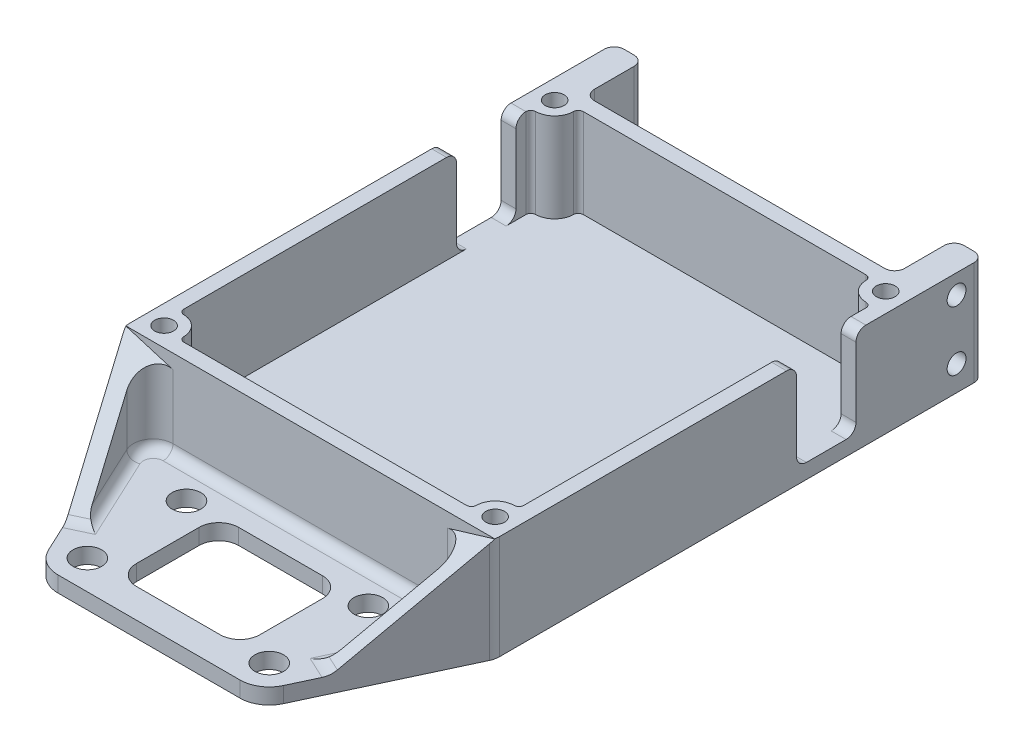
from build123d import *

# Parameters (mm, degrees)
SKETCH1_W           = 74.6
SKETCH1_H           = 86.6
BOSS_EXTRUDE1_DEPTH = 21
SHELL1_T            = -3
SKETCH3_R           = 2.9
SKETCH3_W           = 24.9
SKETCH3_H           = 20.6375
BOSS_EXTRUDE2_DEPTH = 3.175
FILLET2_R           = 4
BOSS_EXTRUDE3_DEPTH = 3
FILLET3_R           = 4
FILLET4_R           = 4
FILLET5_R           = 2
SKETCH5_W           = 12
SKETCH5_H           = 20
CUT_EXTRUDE1_DEPTH  = 37.3
CUT_EXTRUDE2_DEPTH  = 37.3
FILLET6_R           = 2
BOSS_EXTRUDE4_DEPTH = 21
FILLET7_R           = 2
FILLET8_R           = 2
SKETCH8_R           = 1.9
CUT_EXTRUDE3_DEPTH  = 5
SKETCH9_R           = 3.9
BOSS_EXTRUDE5_DEPTH = 21
FILLET9_R           = 1
CUT_EXTRUDE4_START  = -10
SKETCH10_R          = 1.9
CUT_EXTRUDE4_DEPTH  = 10


with BuildPart() as part:
    # Sketch1 → Boss-Extrude1 (new body)
    with BuildSketch(Plane(origin=(0, 0, 0), x_dir=(1, 0, 0), z_dir=(0, 1, 0))):
        Rectangle(SKETCH1_W, SKETCH1_H)
    extrude(amount=BOSS_EXTRUDE1_DEPTH)

    # Shell1
    shell1_openings = [part.faces().sort_by_distance(p)[0] for p in [
        (0, 21, 0),
    ]]
    offset(amount=SHELL1_T, openings=shell1_openings, kind=Kind.INTERSECTION)

    # Sketch3 → Boss-Extrude2 (add)
    with BuildSketch(Plane(origin=(0, 0, 0), x_dir=(1, 0, 0), z_dir=(0, 1, 0))):
        with BuildLine():
            Line((-37.3, -43.3), (-23.695893814, -72.433781099))
            ThreePointArc((-23.695893814, -72.433781099), (-21.518749084, -74.914349329), (-18.35, -75.8375))
            Line((-18.35, -75.8375), (18.35, -75.8375))
            ThreePointArc((18.35, -75.8375), (21.518749084, -74.914349329), (23.695893814, -72.433781099))
            Line((23.695893814, -72.433781099), (37.3, -43.3))
            Line((37.3, -43.3), (-37.3, -43.3))
        make_face()
        with Locations(Location((-18.35, -69.9375, 0), (0, 0, 270))):
            Circle(SKETCH3_R, mode=Mode.SUBTRACT)
        with Locations(Location((18.35, -69.9375, 0), (0, 0, 270))):
            Circle(SKETCH3_R, mode=Mode.SUBTRACT)
        with Locations(Location((18.35, -49.9375, 0), (0, 0, 270))):
            Circle(SKETCH3_R, mode=Mode.SUBTRACT)
        with Locations(Location((-18.35, -49.9375, 0), (0, 0, 270))):
            Circle(SKETCH3_R, mode=Mode.SUBTRACT)
        with Locations((0, -59.61875)):
            Rectangle(SKETCH3_W, SKETCH3_H, mode=Mode.SUBTRACT)
    extrude(amount=BOSS_EXTRUDE2_DEPTH)

    # Fillet2
    fillet2_edges = [part.edges().sort_by_distance(p)[0] for p in [
        (12.45, 1.5875, 69.9375),
        (12.45, 1.5875, 49.3),
        (-12.45, 1.5875, 49.3),
        (-12.45, 1.5875, 69.9375),
    ]]
    fillet(fillet2_edges, radius=FILLET2_R)

    # Sketch4 → Boss-Extrude3 (add)
    with BuildSketch(Plane(origin=(47.22244251, 0, 22.050660711), x_dir=(0.4230984913948713, 0, -0.9060836973367219), z_dir=(0.9060836973367219, 0, 0.4230984913948713))):
        Polygon((-23.451850366, 3.175), (-23.451850366, 21), (-48.451850366, 3.175), align=None)
    boss_extrude3 = extrude(amount=-BOSS_EXTRUDE3_DEPTH)

    # Mirror1: Boss-Extrude3 across plane
    add(boss_extrude3.mirror(Plane(origin=(0, 0, 0), x_dir=(0, 0, 1), z_dir=(1, 0, 0))))

    # Fillet3
    # the kernel refuses this fillet: 4 mm, written as the material it adds along each edge
    with BuildSketch(Plane(origin=(33.989047591, 35.70722548, 43.3), x_dir=(-1, 0, 0), z_dir=(0, -1, 0))) as fillet3_piece_1_section:
        with BuildLine():
            CenterArc((FILLET3_R * 1.57060379254, -FILLET3_R), FILLET3_R, 90, 115.030363343)
            Line((FILLET3_R * 0.664520095202, -FILLET3_R * 1.42309849139), (0, 0))
            Line((0, 0), (FILLET3_R * 1.57060379254, 0))
        make_face()
    fillet3_piece_1 = extrude(amount=32.53222548, mode=Mode.PRIVATE)
    fillet3_piece_1 = split(fillet3_piece_1, bisect_by=Plane(origin=(30.311758397, 15.920235221, 47.899774075), z_dir=(0.2456276241787504, -0.8142283147913327, -0.526022168384916)), keep=Keep.TOP, mode=Mode.PRIVATE)
    add(fillet3_piece_1)
    with BuildSketch(Plane(origin=(-33.989047591, 35.70722548, 43.3), x_dir=(1, 0, 0), z_dir=(0, -1, 0))) as fillet3_piece_2_section:
        with BuildLine():
            CenterArc((FILLET3_R * 1.57060379254, FILLET3_R), FILLET3_R, 154.969636657, 115.030363343)
            Line((FILLET3_R * 0.664520095202, FILLET3_R * 1.42309849139), (0, 0))
            Line((0, 0), (FILLET3_R * 1.57060379254, 0))
        make_face()
    fillet3_piece_2 = extrude(amount=32.53222548, mode=Mode.PRIVATE)
    fillet3_piece_2 = split(fillet3_piece_2, bisect_by=Plane(origin=(-30.311758397, 15.920235221, 47.899774075), z_dir=(-0.2456276241787504, -0.8142283147913327, -0.526022168384916)), keep=Keep.TOP, mode=Mode.PRIVATE)
    add(fillet3_piece_2)
    # the kernel refuses this fillet: 4 mm, written as the material it takes off along each edge
    with BuildSketch(Plane(origin=(37.3, -2.21972672, 43.3), x_dir=(0, 0, -1), z_dir=(0, 1, 0)), Plane(origin=(-37.3, -2.21972672, 43.3), x_dir=(0.42309849139487515, 0, 0.9060836973367199), z_dir=(0, 1, 0))) as fillet3_2_piece_1:
        with BuildLine():
            CenterArc((FILLET3_R * 0.221972672022, FILLET3_R), FILLET3_R, 244.969636657, 25.030363343)
            Line((-FILLET3_R * 0.201125819373, FILLET3_R * 0.0939163026633), (0, 0))
            Line((0, 0), (FILLET3_R * 0.221972672022, 0))
        make_face()
    extrude(amount=25.43945344, mode=Mode.SUBTRACT)
    with BuildSketch(Plane(origin=(-37.3, -10, -43.3), x_dir=(0, 0, 1), z_dir=(0, 1, 0))) as fillet3_2_piece_2:
        with BuildLine():
            CenterArc((FILLET3_R, FILLET3_R), FILLET3_R, 180, 90)
            Line((0, FILLET3_R), (0, 0))
            Line((0, 0), (FILLET3_R, 0))
        make_face()
    extrude(amount=41, mode=Mode.SUBTRACT)
    with BuildSketch(Plane(origin=(37.3, -10, -43.3), x_dir=(0, 0, 1), z_dir=(0, 1, 0))) as fillet3_2_piece_3:
        with BuildLine():
            CenterArc((FILLET3_R, -FILLET3_R), FILLET3_R, 90, 90)
            Line((0, -FILLET3_R), (0, 0))
            Line((0, 0), (FILLET3_R, 0))
        make_face()
    extrude(amount=41, mode=Mode.SUBTRACT)

    # Fillet4
    fillet4_edges = [part.edges().sort_by_distance(p)[0] for p in [
        (-25.363412169, 3.175, 65.317444696),
        (25.363412169, 3.175, 65.317444696),
    ]]
    fillet(fillet4_edges, radius=FILLET4_R)

    # Fillet5
    fillet5_edges = [part.edges().sort_by_distance(p)[0] for p in [
        (34.3, 12, 40.3),
        (34.3, 12, -40.3),
        (-34.3, 12, -40.3),
        (-34.3, 12, 40.3),
    ]]
    fillet(fillet5_edges, radius=FILLET5_R)

    # Sketch5 → Cut-Extrude1 (cut)
    with BuildSketch(Plane(origin=(0, 0, 0), x_dir=(0, 0, -1), z_dir=(1, 0, 0))):
        with Locations((26.5, 13)):
            Rectangle(SKETCH5_W, SKETCH5_H)
    extrude(amount=-CUT_EXTRUDE1_DEPTH, mode=Mode.SUBTRACT)

    # Sketch6 → Cut-Extrude2 (cut)
    with BuildSketch(Plane(origin=(0, 0, 0), x_dir=(0, 0, -1), z_dir=(1, 0, 0))):
        Polygon((29.5, 21), (17.5, 21), (17.5, 17), (17.5, 3), (29.5, 3), (29.5, 17), align=None)
    extrude(amount=CUT_EXTRUDE2_DEPTH, mode=Mode.SUBTRACT)

    # Fillet6
    fillet6_edges = [part.edges().sort_by_distance(p)[0] for p in [
        (-35.8, 21, -20.5),
        (-35.8, 21, -32.5),
        (-35.8, 3, -32.5),
        (-35.8, 3, -20.5),
        (35.8, 3, -29.5),
        (35.8, 3, -17.5),
        (35.8, 21, -17.5),
        (35.8, 21, -29.5),
    ]]
    fillet(fillet6_edges, radius=FILLET6_R)

    # Sketch7 → Boss-Extrude4 (add)
    with BuildSketch(Plane(origin=(0, 0, 0), x_dir=(1, 0, 0), z_dir=(0, 1, 0))):
        with BuildLine():
            Line((-37.3, 55.3), (-37.3, 39.3))
            ThreePointArc((-37.3, 39.3), (-36.128427125, 42.128427125), (-33.3, 43.3))
            Line((-33.3, 43.3), (-31.3, 43.3))
            Line((-31.3, 43.3), (-31.3, 55.3))
            Line((-31.3, 55.3), (-37.3, 55.3))
        make_face()
        with BuildLine():
            Line((31.3, 55.3), (31.3, 43.3))
            Line((31.3, 43.3), (33.3, 43.3))
            ThreePointArc((33.3, 43.3), (36.128427125, 42.128427125), (37.3, 39.3))
            Line((37.3, 39.3), (37.3, 55.3))
            Line((37.3, 55.3), (31.3, 55.3))
        make_face()
    extrude(amount=BOSS_EXTRUDE4_DEPTH)

    # Fillet7
    fillet7_edges = [part.edges().sort_by_distance(p)[0] for p in [
        (-37.3, 10.5, -55.3),
        (-31.3, 10.5, -55.3),
        (-31.3, 10.5, -43.3),
        (31.3, 10.5, -43.3),
        (31.3, 10.5, -55.3),
        (37.3, 10.5, -55.3),
    ]]
    fillet(fillet7_edges, radius=FILLET7_R)

    # Fillet8
    fillet8_edges = [part.edges().sort_by_distance(p)[0] for p in [
        (-27.396847741, 3.175, 57.417480766),
        (-31.08076756, 3.175, 45.151695536),
        (0, 3.175, 43.3),
        (31.08076756, 3.175, 45.151695536),
        (27.396847741, 3.175, 57.417480766),
    ]]
    fillet(fillet8_edges, radius=FILLET8_R)

    # Sketch8 → Cut-Extrude3 (cut)
    with BuildSketch(Plane(origin=(37.3, 0, 0), x_dir=(0, 0, -1), z_dir=(1, 0, 0))):
        with Locations((49.8, 5.096033911)):
            Circle(SKETCH8_R)
        with Locations((49.8, 17.096033911)):
            Circle(SKETCH8_R)
    cut_extrude3 = extrude(amount=-CUT_EXTRUDE3_DEPTH, mode=Mode.SUBTRACT)

    # Mirror2: Cut-Extrude3 across plane
    add(cut_extrude3.mirror(Plane(origin=(0, 0, 0), x_dir=(0, 0, 1), z_dir=(1, 0, 0))), mode=Mode.SUBTRACT)

    # Sketch9 → Boss-Extrude5 (add)
    with BuildSketch(Plane(origin=(0, 0, 0), x_dir=(1, 0, 0), z_dir=(0, 1, 0))):
        with Locations((33.4, 39.4)):
            Circle(SKETCH9_R)
        with Locations((-33.4, 39.4)):
            Circle(SKETCH9_R)
        with Locations((33.4, -39.4)):
            Circle(SKETCH9_R)
        with Locations((-33.4, -39.4)):
            Circle(SKETCH9_R)
    extrude(amount=BOSS_EXTRUDE5_DEPTH)

    # Fillet9
    fillet9_edges = [part.edges().sort_by_distance(p)[0] for p in [
        (34.3, 12, -35.605266808),
        (29.605266808, 12, -40.3),
        (-29.605266808, 12, -40.3),
        (-34.3, 12, -35.605266808),
        (29.605266808, 12, 40.3),
        (34.3, 12, 35.605266808),
        (-34.3, 12, 35.605266808),
        (-29.605266808, 12, 40.3),
    ]]
    fillet(fillet9_edges, radius=FILLET9_R)

    # Sketch10 → Cut-Extrude4 (cut)
    with BuildSketch(Plane(origin=(0, 21, 0), x_dir=(1, 0, 0), z_dir=(0, 1, 0)).offset(CUT_EXTRUDE4_START)):
        with Locations(Location((33.4, 39.4, 0), (0, 0, 270))):
            Circle(SKETCH10_R)
        with Locations(Location((-33.4, 39.4, 0), (0, 0, 270))):
            Circle(SKETCH10_R)
        with Locations(Location((-33.4, -39.4, 0), (0, 0, 270))):
            Circle(SKETCH10_R)
        with Locations(Location((33.4, -39.4, 0), (0, 0, 270))):
            Circle(SKETCH10_R)
    extrude(amount=CUT_EXTRUDE4_DEPTH, mode=Mode.SUBTRACT)


solid = part.part
